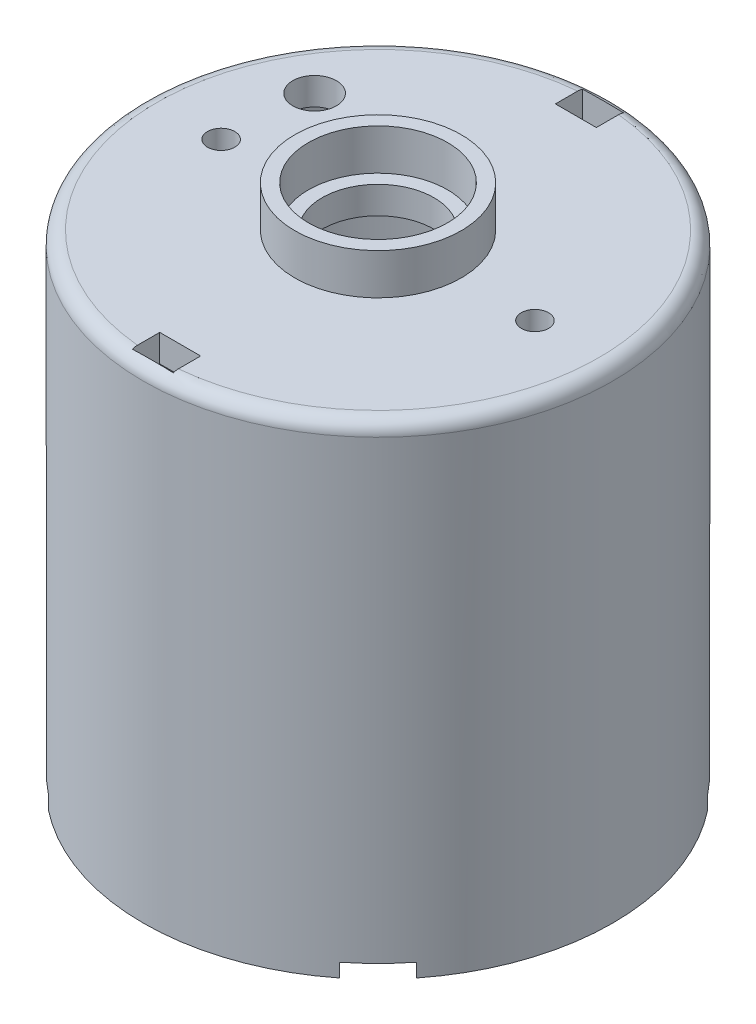
from build123d import *

# Parameters (mm, degrees)
SKETCH_1_R               = 8.6
EXTRUDE_1_DEPTH          = 17.7
SKETCH_2_R               = 3.05
SKETCH_2_R_2             = 2.55
EXTRUDE_2_DEPTH          = 1.5
SHELL_4_OUTLINE_R        = 7.6
SHELL_4_DEPTH            = 16.7
SHELL_START              = 16.7
SHELL_4_2_OUTLINE_R      = 2.05
SHELL_4_2_DEPTH          = 1
SKETCH_5_R               = 0.8
SKETCH_5_R_2             = 0.5
SKETCH_5_W               = 1.5
SKETCH_5_H               = 1
CUT_EXTRUDE_5_DEPTH      = 1.5
CUT_EXTRUDE_6_DEPTH      = 0.5
PATTERN_CIRCULAR_1_COUNT = 4
FILLET_1_R               = 0.5


# Read off the part's stored shape, not the designer's step: 薄殼4
with BuildPart() as part:
    # 草圖1 → 伸長1 (new body)
    with BuildSketch(Plane(origin=(0, 0, 0), x_dir=(1, 0, 0), z_dir=(0, 1, 0))):
        with Locations(Location((0, 0, 0), (0, 0, 270))):
            Circle(SKETCH_1_R)
    extrude(amount=EXTRUDE_1_DEPTH)

    # 草圖2 → 伸長2 (add)
    with BuildSketch(Plane(origin=(0, 17.7, 0), x_dir=(1, 0, 0), z_dir=(0, 1, 0))):
        with Locations(Location((0, 0, 0), (0, 0, 270))):
            Circle(SKETCH_2_R)
        with Locations(Location((0, 0, 0), (0, 0, 270))):
            Circle(SKETCH_2_R_2, mode=Mode.SUBTRACT)
    extrude(amount=EXTRUDE_2_DEPTH)

    # 薄殼4 outline → 薄殼4 (cut)
    with BuildSketch(Plane(origin=(0, 0, 0), x_dir=(1, 0, 0), z_dir=(0, 1, 0))):
        Circle(SHELL_4_OUTLINE_R)
    extrude(amount=SHELL_4_DEPTH, mode=Mode.SUBTRACT)

    # Shell 4 2 outline → Shell 4 2 (cut)
    with BuildSketch(Plane(origin=(0, 0, 0), x_dir=(1, 0, 0), z_dir=(0, 1, 0)).offset(SHELL_START)):
        Circle(SHELL_4_2_OUTLINE_R)
    extrude(amount=SHELL_4_2_DEPTH, mode=Mode.SUBTRACT)

    # 草圖5 → 伸長5 (cut)
    with BuildSketch(Plane(origin=(0, 17.7, 0), x_dir=(1, 0, 0), z_dir=(0, 1, 0))):
        with Locations(Location((-5.5, 3.175426481, 0), (0, 0, 270))):
            Circle(SKETCH_5_R)
        with Locations(Location((-5.75, 0, 0), (0, 0, 270))):
            Circle(SKETCH_5_R_2)
        with Locations(Location((5.75, 0, 0), (0, 0, 270))):
            Circle(SKETCH_5_R_2)
        with Locations((0, 7.75)):
            Rectangle(SKETCH_5_W, SKETCH_5_H)
        with Locations((0, -7.75)):
            Rectangle(SKETCH_5_W, SKETCH_5_H)
    extrude(amount=-CUT_EXTRUDE_5_DEPTH, mode=Mode.SUBTRACT)

    # 草圖7 → 伸長6 (cut)
    with BuildSketch(Plane.XZ):
        Polygon((-5.762920267, 4.348706704), (-6.965001795, 5.550788232), (-5.550788232, 6.965001795), (-4.348706704, 5.762920267), align=None)
    cut_extrude_6 = extrude(amount=-CUT_EXTRUDE_6_DEPTH, mode=Mode.SUBTRACT)

    # 環狀複製排列1: 伸長6 ×4 about axis
    pattern_circular_1_axis = Axis((0, 0, 0), (0, 1, 0))
    for i in range(1, PATTERN_CIRCULAR_1_COUNT):
        add(cut_extrude_6.rotate(pattern_circular_1_axis, i * 360 / PATTERN_CIRCULAR_1_COUNT), mode=Mode.SUBTRACT)

    # 圓角1
    # the kernel refuses this fillet: 0.5 mm, written as the material it takes off along each edge
    with BuildSketch(Plane(origin=(0, 17.7, 0), x_dir=(0, 0, 1), z_dir=(-1, 0, 0))) as fillet_1_piece_1:
        with BuildLine():
            CenterArc((8.6 - FILLET_1_R, -FILLET_1_R), FILLET_1_R, 0, 90)
            Line((8.6 - FILLET_1_R, 0), (8.6, 0))
            Line((8.6, 0), (8.6, -FILLET_1_R))
        make_face()
    revolve(axis=Axis((0, 17.7, 0), (0, 1, 0)), mode=Mode.SUBTRACT)


solid = part.part
